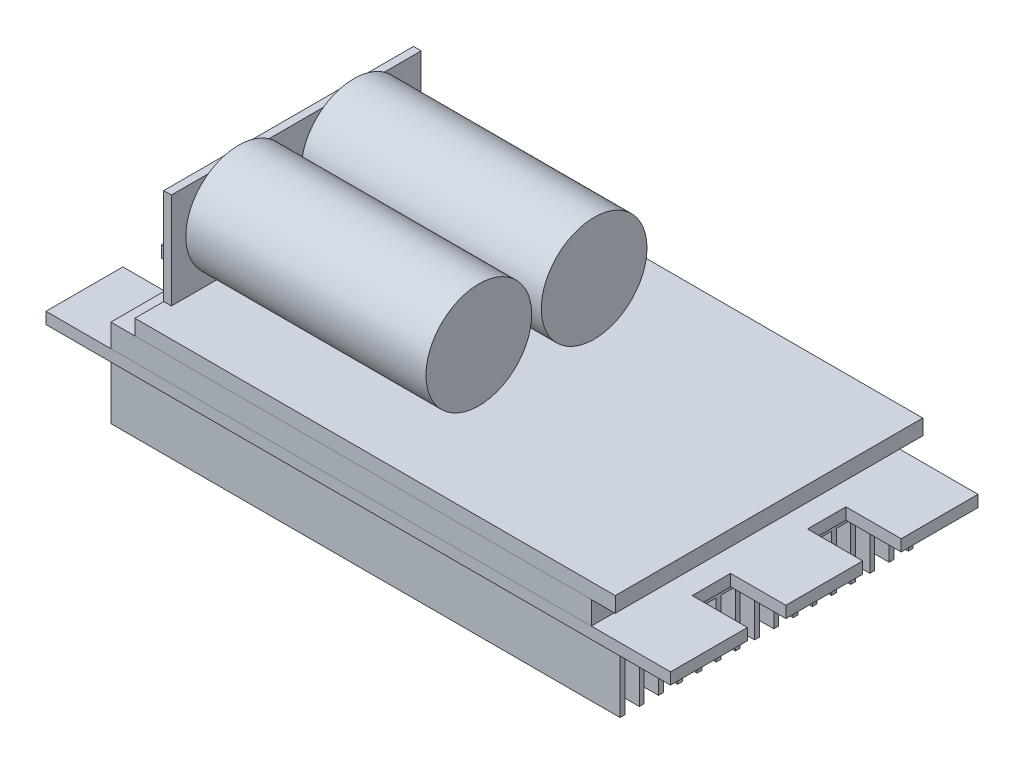
from build123d import *

# Parameters (mm, degrees)
BOSS_EXTRUDE1_DEPTH   = 1.2
SKETCH2_W             = 50
SKETCH2_H             = 32
BOSS_EXTRUDE2_DEPTH   = 2.4
SKETCH3_W             = 50
SKETCH3_H             = 32
BOSS_EXTRUDE3_DEPTH   = 1.6
SKETCH4_W             = 0.8
SKETCH4_H             = 26
BOSS_EXTRUDE4_DEPTH   = 10
SKETCH5_R             = 5.5
BOSS_EXTRUDE6_DEPTH   = 25
BOSS_EXTRUDE6_2_DEPTH = 25
SKETCH6_W             = 53
SKETCH6_H             = 30.5
BOSS_EXTRUDE7_DEPTH   = 6.3
CUT_EXTRUDE7_DEPTH    = 64.24112586


with BuildPart() as part:
    # Sketch1 → Boss-Extrude1 (new body)
    with BuildSketch(Plane(origin=(0, 0, 0), x_dir=(1, 0, 0), z_dir=(0, 1, 0))):
        Polygon((-26.75, 16), (-32.5, 16), (-32.5, 8), (-26.75, 8), (-26.75, 4), (-32.5, 4), (-32.5, -4), (-26.75, -4), (-26.75, -8), (-32.5, -8), (-32.5, -16), (-26.75, -16), (26.75, -16), (32.5, -16), (32.5, -8), (26.75, -8), (26.75, -4), (32.5, -4), (32.5, 4), (26.75, 4), (26.75, 8), (32.5, 8), (32.5, 16), (26.75, 16), align=None)
    extrude(amount=BOSS_EXTRUDE1_DEPTH)

    # Sketch6 → Boss-Extrude7 (add)
    with BuildSketch(Plane(origin=(0, 0, 0), x_dir=(-1, 0, 0), z_dir=(0, -1, 0))):
        Rectangle(SKETCH6_W, SKETCH6_H)
    extrude(amount=BOSS_EXTRUDE7_DEPTH)

    # Sketch8 → Cut-Extrude7 (cut, through all)
    with BuildSketch(Plane(origin=(26.5, 0, 0), x_dir=(0, 0, -1), z_dir=(1, 0, 0))):
        Polygon((-15.25, -6.3), (-15.25, 0), (-23.612450935, 0), (-23.612450935, -15.947306279), (23.612450935, -15.947306279), (23.612450935, 0), (15.25, 0), (15.25, -6.3), (14.75, -6.3), (14.75, -0.5), (13.25, -0.5), (13.25, -6.3), (12.75, -6.3), (12.75, -0.5), (11.25, -0.5), (11.25, -6.3), (10.75, -6.3), (10.75, -0.5), (9.25, -0.5), (9.25, -6.3), (8.75, -6.3), (8.75, -0.5), (7.25, -0.5), (7.25, -6.3), (6.75, -6.3), (6.75, -0.5), (5.25, -0.5), (5.25, -6.3), (4.75, -6.3), (4.75, -0.5), (3.25, -0.5), (3.25, -6.3), (2.75, -6.3), (2.75, -0.5), (1.25, -0.5), (1.25, -6.3), (0.75, -6.3), (0.75, -0.5), (-0.75, -0.5), (-0.75, -6.3), (-1.25, -6.3), (-1.25, -0.5), (-2.75, -0.5), (-2.75, -6.3), (-3.25, -6.3), (-3.25, -0.5), (-4.75, -0.5), (-4.75, -6.3), (-5.25, -6.3), (-5.25, -0.5), (-6.75, -0.5), (-6.75, -6.3), (-7.25, -6.3), (-7.25, -0.5), (-8.75, -0.5), (-8.75, -6.3), (-9.25, -6.3), (-9.25, -0.5), (-10.75, -0.5), (-10.75, -6.3), (-11.25, -6.3), (-11.25, -0.5), (-12.75, -0.5), (-12.75, -6.3), (-13.25, -6.3), (-13.25, -0.5), (-14.75, -0.5), (-14.75, -6.3), align=None)
    extrude(amount=-CUT_EXTRUDE7_DEPTH, mode=Mode.SUBTRACT)


with BuildPart() as body_2:
    # Sketch2 → Boss-Extrude2 (new body)
    with BuildSketch(Plane(origin=(0, 1.2, 0), x_dir=(1, 0, 0), z_dir=(0, 1, 0))):
        with Locations((-0.75, 0)):
            Rectangle(SKETCH2_W, SKETCH2_H)
    extrude(amount=BOSS_EXTRUDE2_DEPTH)


with BuildPart() as body_3:
    # Sketch3 → Boss-Extrude3 (new body)
    with BuildSketch(Plane(origin=(0, 3.6, 0), x_dir=(1, 0, 0), z_dir=(0, 1, 0))):
        with Locations((1.75, 0)):
            Rectangle(SKETCH3_W, SKETCH3_H)
    extrude(amount=BOSS_EXTRUDE3_DEPTH)

    # Sketch4 → Boss-Extrude4 (add)
    with BuildSketch(Plane(origin=(0, 5.2, 0), x_dir=(1, 0, 0), z_dir=(0, 1, 0))):
        with Locations((-22.85, 0)):
            Rectangle(SKETCH4_W, SKETCH4_H)
    extrude(amount=BOSS_EXTRUDE4_DEPTH)


with BuildPart() as body_4:
    # Sketch5 → Boss-Extrude6 (new body)
    with BuildSketch(Plane(origin=(-22.45, 0, 0), x_dir=(0, 0, -1), z_dir=(1, 0, 0))):
        with Locations((-6, 10.7)):
            Circle(SKETCH5_R)
    extrude(amount=BOSS_EXTRUDE6_DEPTH)


with BuildPart() as body_5:
    # Sketch5 → Boss-Extrude6 2 (new body)
    with BuildSketch(Plane(origin=(-22.45, 0, 0), x_dir=(0, 0, -1), z_dir=(1, 0, 0))):
        with Locations((6, 10.7)):
            Circle(SKETCH5_R)
    extrude(amount=BOSS_EXTRUDE6_2_DEPTH)


solid = Compound([part.part, body_2.part, body_3.part, body_4.part, body_5.part])
